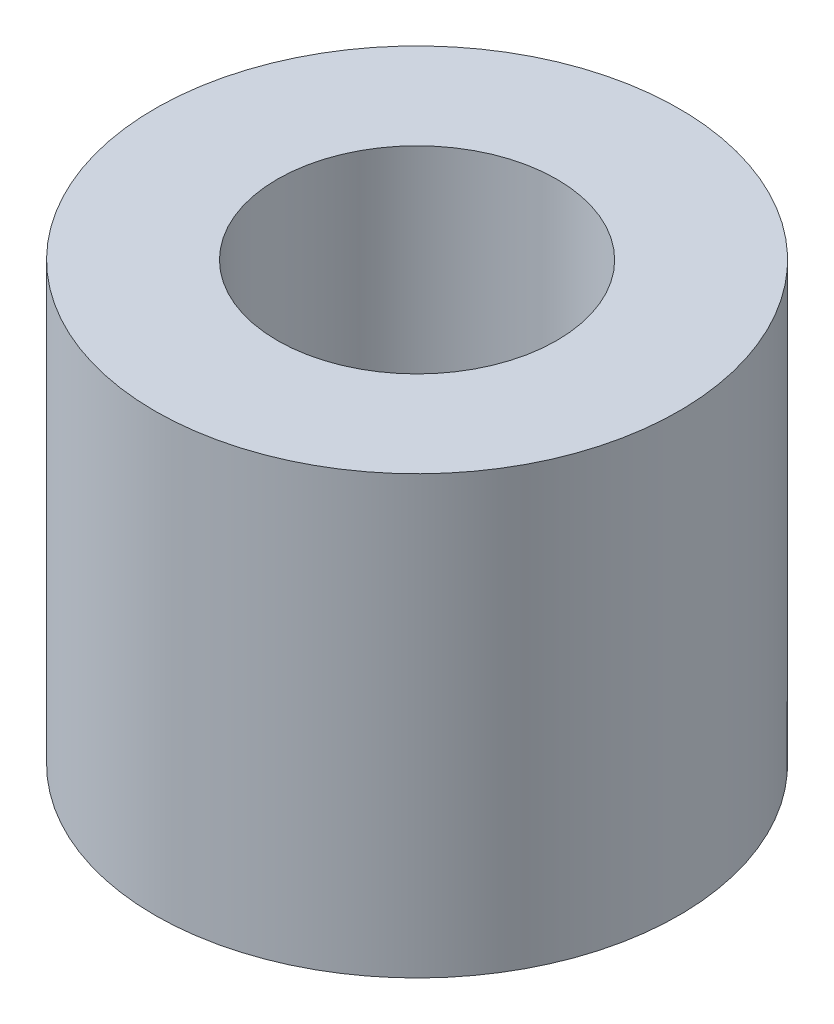
from build123d import *

# Parameters (mm, degrees)
SKICA1_R                = 3
SKICA1_R_2              = 1.6
P_IDAT_VYSUNUT_M1_DEPTH = 5


with BuildPart() as part:
    # Skica1 → Přidat vysunutím1 (new body)
    with BuildSketch(Plane(origin=(0, 0, 0), x_dir=(1, 0, 0), z_dir=(0, 1, 0))):
        Circle(SKICA1_R)
        Circle(SKICA1_R_2, mode=Mode.SUBTRACT)
    extrude(amount=P_IDAT_VYSUNUT_M1_DEPTH)


solid = part.part
